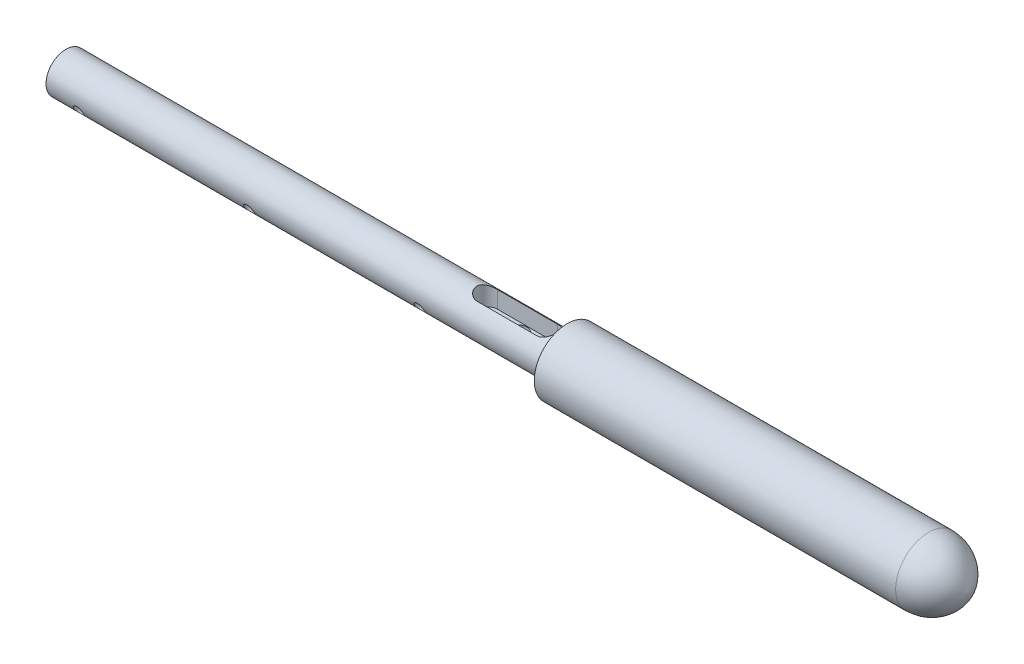
from build123d import *

# Parameters (mm, degrees)
SKETCH1_R                       = 3.175
BOSS_EXTRUDE1_DEPTH             = 127
CUT_EXTRUDE2_DEPTH              = 3.175
F_32_0_116_DIAMETER_HOLE1_D     = 2.9464
F_32_0_116_DIAMETER_HOLE1_DEPTH = 25.4
F_32_0_116_DIAMETER_HOLE1_TIP   = 0.885187864
SKETCH7_R                       = 0.79375
CUT_EXTRUDE3_DEPTH              = 5.08
SKETCH10_W                      = 9.525
SKETCH10_H                      = 1.5875
SKETCH10_W_2                    = 6.35
CUT_EXTRUDE4_DEPTH              = 5.715
LPATTERN1_COUNT                 = 3
LPATTERN1_PITCH                 = 26.9875


with BuildPart() as part:
    # Sketch1 → Boss-Extrude1 (new body)
    with BuildSketch(Plane(origin=(0, 0, 0), x_dir=(0, 0, -1), z_dir=(1, 0, 0))):
        Circle(SKETCH1_R)
    extrude(amount=BOSS_EXTRUDE1_DEPTH)

    # Sketch2 → Revolve1 (revolve)
    with BuildSketch(Plane.XY):
        with BuildLine():
            Line((142.875, 0), (79.375, 0))
            Line((79.375, 0), (79.375, 5.207))
            Line((79.375, 5.207), (136.628717025, 5.207))
            ThreePointArc((136.628717025, 5.207), (140.694700916, 3.73452755), (142.875, 0))
        make_face()
    revolve(axis=Axis((127, 0, 0), (-1, 0, 0)))

    # Sketch4 → Cut-Extrude2 (cut)
    with BuildSketch(Plane(origin=(0, 0, 0), x_dir=(1, 0, 0), z_dir=(0, 1, 0))):
        with BuildLine():
            Line((76.2, 1.671783879), (66.675, 1.671783879))
            ThreePointArc((66.675, 1.671783879), (65.041030381, 0.03781426), (66.675, -1.596155359))
            Line((66.675, -1.596155359), (76.2, -1.596155359))
            ThreePointArc((76.2, -1.596155359), (77.833969619, 0.03781426), (76.2, 1.671783879))
        make_face()
    extrude(amount=CUT_EXTRUDE2_DEPTH, mode=Mode.SUBTRACT)

    # #32 (0.116) Diameter Hole1
    with Locations(Plane(origin=(0, 0, 0), x_dir=(-1, 0, 0), z_dir=(0, 1, 0))):
        with Locations((-71.4375, -0.084283879)):
            Hole(F_32_0_116_DIAMETER_HOLE1_D / 2, depth=F_32_0_116_DIAMETER_HOLE1_DEPTH)
            with Locations((0, 0, -(F_32_0_116_DIAMETER_HOLE1_DEPTH + F_32_0_116_DIAMETER_HOLE1_TIP / 2))):  # 118° drill point
                Cone(0, F_32_0_116_DIAMETER_HOLE1_D / 2, F_32_0_116_DIAMETER_HOLE1_TIP, mode=Mode.SUBTRACT)

    # Sketch7 → Cut-Extrude3 (cut, symmetric)
    with BuildSketch(Plane.XY):
        with Locations((4.7625, -1.5875)):
            Circle(SKETCH7_R)
    cut_extrude3 = extrude(amount=CUT_EXTRUDE3_DEPTH, both=True, mode=Mode.SUBTRACT)

    # Sketch10 → Cut-Extrude4 (cut)
    with BuildSketch(Plane(origin=(0, 0, 0), x_dir=(1, 0, 0), z_dir=(0, 1, 0))):
        with Locations((4.7625, 0)):
            Rectangle(SKETCH10_W, SKETCH10_H)
        with Locations((31.75, 0)):
            Rectangle(SKETCH10_W_2, SKETCH10_H)
        with Locations((58.7375, 0)):
            Rectangle(SKETCH10_W, SKETCH10_H)
    extrude(amount=-CUT_EXTRUDE4_DEPTH, mode=Mode.SUBTRACT)

    # LPattern1: Cut-Extrude3 ×3
    with Locations(*[(i * LPATTERN1_PITCH, 0, 0) for i in range(1, LPATTERN1_COUNT)]):
        add(cut_extrude3, mode=Mode.SUBTRACT)


solid = part.part
